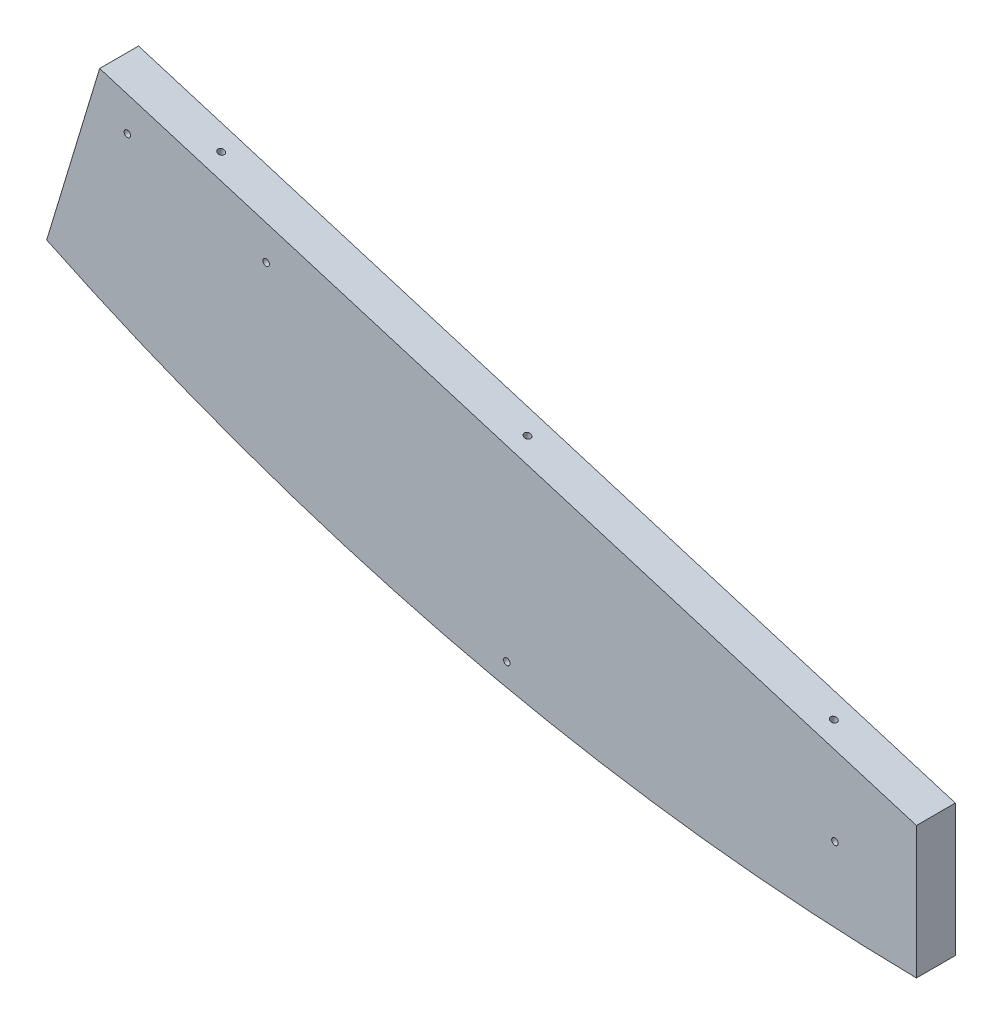
from build123d import *

# Parameters (mm, degrees)
BOSS_EXTRUDE1_DEPTH = 19.05
HOLE1_D             = 3.175
HOLE1_DEPTH         = 31.75
HOLE1_CSINK_D       = 10.16
HOLE1_CSINK_ANGLE   = 82
HOLE1_TIP           = 0.953866233
HOLE2_D             = 3.175
HOLE2_DEPTH         = 31.75
HOLE2_CSINK_D       = 10.16
HOLE2_CSINK_ANGLE   = 82
HOLE2_TIP           = 0.953866233
HOLE3_D             = 3.175
HOLE3_DEPTH         = 31.75
HOLE3_CSINK_D       = 10.16
HOLE3_CSINK_ANGLE   = 82
HOLE3_TIP           = 0.953866233
HOLE4_D             = 3.175
HOLE4_DEPTH         = 38.1
HOLE4_CSINK_D       = 10.16
HOLE4_CSINK_ANGLE   = 82
HOLE4_TIP           = 0.953866233
HOLE7_D             = 3.175
HOLE7_DEPTH         = 38.1
HOLE7_CSINK_D       = 10.16
HOLE7_CSINK_ANGLE   = 82
HOLE7_TIP           = 0.953866233


with BuildPart() as part:
    # Sketch1 → Boss-Extrude1 (new body)
    with BuildSketch(Plane.XY):
        with BuildLine():
            Line((-400.14087824, 384.351673867), (0, 263.246933614))
            Line((0, 263.246933614), (0, 198.540015411))
            ThreePointArc((0, 198.540015411), (-218.499895643, 225.348843149), (-426.096351675, 298.59247143))
            Line((-426.096351675, 298.59247143), (-400.14087824, 384.351673867))
        make_face()
    extrude(amount=-BOSS_EXTRUDE1_DEPTH)

    # Hole1
    with Locations(Plane(origin=(390.375064111, 158.3667868, -217.299999994), x_dir=(0, 0, -1), z_dir=(0.2896786029738461, 0.9571239768071433, 0))):
        with Locations((207.774999994, 613.051808534), (-207.774999994, 613.051808534), (-207.774999994, 456.277103296), (-207.774999994, 769.826513772), (-108.649999997, 456.277103296), (-108.649999997, 613.051808534), (-108.649999997, 769.826513772), (-207.774999994, 362.200879148), (-207.774999994, 305.10273792), (0, 305.10273792), (0, 362.200879148), (207.774999994, 305.10273792), (207.774999994, 362.200879148), (108.649999997, 769.826513772), (108.649999997, 613.051808534), (108.649999997, 456.277103296), (207.774999994, 769.826513772), (207.774999994, 456.277103296)):
            CounterSinkHole(HOLE1_D / 2, HOLE1_CSINK_D / 2, depth=HOLE1_DEPTH, counter_sink_angle=HOLE1_CSINK_ANGLE)
            with Locations((0, 0, -(HOLE1_DEPTH + HOLE1_TIP / 2))):  # 118° drill point
                Cone(0, HOLE1_D / 2, HOLE1_TIP, mode=Mode.SUBTRACT)

    # Hole2
    with Locations(Plane(origin=(277.286738577, -215.287141225, 12.7), x_dir=(-0.08995962873759034, 0.9959454127598536, 0), z_dir=(0, 0, 1))):
        with Locations((637.870011036, 553.595098153), (52.960474704, 241.752641108), (47.697836423, 183.489834462), (434.459074831, 134.806234549), (453.103621196, 177.188747915), (478.414399376, 275.292665941), (488.870508314, 435.756794718), (636.071223534, 609.111420407), (609.449424187, 543.22015483), (559.371199386, 359.303721429), (507.038658285, 229.776136946)):
            CounterSinkHole(HOLE2_D / 2, HOLE2_CSINK_D / 2, depth=HOLE2_DEPTH, counter_sink_angle=HOLE2_CSINK_ANGLE)
            with Locations((0, 0, -(HOLE2_DEPTH + HOLE2_TIP / 2))):  # 118° drill point
                Cone(0, HOLE2_D / 2, HOLE2_TIP, mode=Mode.SUBTRACT)

    # Hole3
    with Locations(Plane(origin=(277.286738577, -215.287141225, -31.75), x_dir=(0.08995962873759034, -0.9959454127598536, 0), z_dir=(0, 0, -1))):
        with Locations((-507.038658285, 229.776136946), (-559.371199386, 359.303721429), (-637.870011036, 553.595098153), (-636.071223534, 609.111420407), (-609.449424187, 543.22015483), (-488.870508314, 435.756794718), (-478.414399376, 275.292665941), (-453.103621196, 177.188747915), (-434.459074831, 134.806234549), (-52.960474704, 241.752641108), (-47.697836423, 183.489834462)):
            CounterSinkHole(HOLE3_D / 2, HOLE3_CSINK_D / 2, depth=HOLE3_DEPTH, counter_sink_angle=HOLE3_CSINK_ANGLE)
            with Locations((0, 0, -(HOLE3_DEPTH + HOLE3_TIP / 2))):  # 118° drill point
                Cone(0, HOLE3_D / 2, HOLE3_TIP, mode=Mode.SUBTRACT)

    # Hole4
    with Locations(Plane(origin=(-521.705760022, 26.532138606, -217.299999994), x_dir=(0, 0, 1), z_dir=(-0.9571239768071419, 0.2896786029738504, 0))):
        with Locations((-108.649999997, 332.89193461), (108.649999997, 332.89193461), (207.774999994, 332.89193461), (174.999999994, 448.336332751), (135.266666663, 384.042401694), (176.283333328, 384.042401694), (-174.999999994, 448.336332751), (-135.266666663, 384.042401694), (-176.283333328, 384.042401694), (-207.774999994, 332.89193461)):
            CounterSinkHole(HOLE4_D / 2, HOLE4_CSINK_D / 2, depth=HOLE4_DEPTH, counter_sink_angle=HOLE4_CSINK_ANGLE)
            with Locations((0, 0, -(HOLE4_DEPTH + HOLE4_TIP / 2))):  # 118° drill point
                Cone(0, HOLE4_D / 2, HOLE4_TIP, mode=Mode.SUBTRACT)

    # Hole7
    with Locations(Plane(origin=(-521.705760022, 26.532138606, 198.249999994), x_dir=(0, 0, 1), z_dir=(-0.9571239768071419, 0.2896786029738504, 0))):
        with Locations((-108.649999997, 332.89193461), (108.649999997, 332.89193461), (207.774999994, 332.89193461), (174.999999994, 448.336332751), (135.266666663, 384.042401694), (176.283333328, 384.042401694), (-174.999999994, 448.336332751), (-135.266666663, 384.042401694), (-176.283333328, 384.042401694), (-207.774999994, 332.89193461)):
            CounterSinkHole(HOLE7_D / 2, HOLE7_CSINK_D / 2, depth=HOLE7_DEPTH, counter_sink_angle=HOLE7_CSINK_ANGLE)
            with Locations((0, 0, -(HOLE7_DEPTH + HOLE7_TIP / 2))):  # 118° drill point
                Cone(0, HOLE7_D / 2, HOLE7_TIP, mode=Mode.SUBTRACT)


solid = part.part
